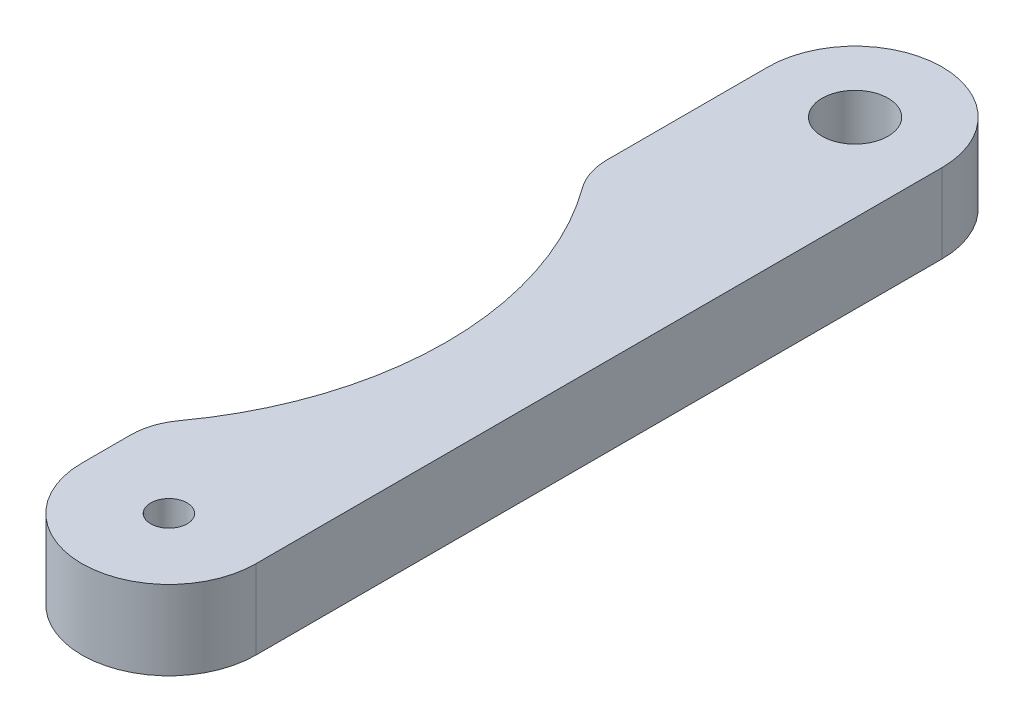
from build123d import *

# Parameters (mm, degrees)
BOSS_EXTRUDE1_DEPTH   = 3.81
F_4_40_TAPPED_HOLE1_D = 1.7526
CUT_EXTRUDE1_DEPTH    = 33.12682719
SKETCH5_R             = 1.5875
CUT_EXTRUDE2_DEPTH    = 33.12682719
FILLET1_R             = 3


with BuildPart() as part:
    # Sketch1 → Boss-Extrude1 (new body)
    with BuildSketch(Plane(origin=(0, 0, 0), x_dir=(1, 0, 0), z_dir=(0, 1, 0))):
        with BuildLine():
            Line((0.307655172, 6.517241379), (0.307655172, -26.502758621))
            ThreePointArc((0.307655172, -26.502758621), (4.498655172, -30.693758621), (8.689655172, -26.502758621))
            Line((8.689655172, -26.502758621), (8.689655172, 6.517241379))
            ThreePointArc((8.689655172, 6.517241379), (4.498655172, 10.708241379), (0.307655172, 6.517241379))
        make_face()
    extrude(amount=BOSS_EXTRUDE1_DEPTH)

    # #4-40 Tapped Hole1 (through all)
    with Locations(Plane(origin=(0, 3.81, 0), x_dir=(1, 0, 0), z_dir=(0, 1, 0))):
        with Locations((4.498655172, 6.517241379), (4.498655172, -26.502758621)):
            Hole(F_4_40_TAPPED_HOLE1_D / 2)

    # Sketch4 → Cut-Extrude1 (cut, through all)
    with BuildSketch(Plane(origin=(0, 3.81, 0), x_dir=(1, 0, 0), z_dir=(0, 1, 0))):
        with BuildLine():
            Line((-105.054689706, 41.50252919), (-22.868233876, -25.472974727))
            ThreePointArc((-22.868233876, -25.472974727), (0.331829627, -23.107123199), (-2.0340219, 0.092940304))
            Line((-2.0340219, 0.092940304), (-84.220477731, 67.068444221))
            Line((-84.220477731, 67.068444221), (-248.593389391, 201.019452054))
            Line((-248.593389391, 201.019452054), (-269.427601367, 175.453537024))
            Line((-269.427601367, 175.453537024), (-105.054689706, 41.50252919))
        make_face()
    extrude(amount=-CUT_EXTRUDE1_DEPTH, mode=Mode.SUBTRACT)

    # Sketch5 → Cut-Extrude2 (cut, through all)
    with BuildSketch(Plane(origin=(0, 3.81, 0), x_dir=(1, 0, 0), z_dir=(0, 1, 0))):
        with Locations((4.498655172, 6.517241379)):
            Circle(SKETCH5_R)
    extrude(amount=-CUT_EXTRUDE2_DEPTH, mode=Mode.SUBTRACT)

    # Fillet1
    fillet1_edges = [part.edges().sort_by_distance(p)[0] for p in [
        (0.307655172, 1.905, 23.136717878),
        (0.307655172, 1.905, 2.243316545),
    ]]
    fillet(fillet1_edges, radius=FILLET1_R)


solid = part.part
